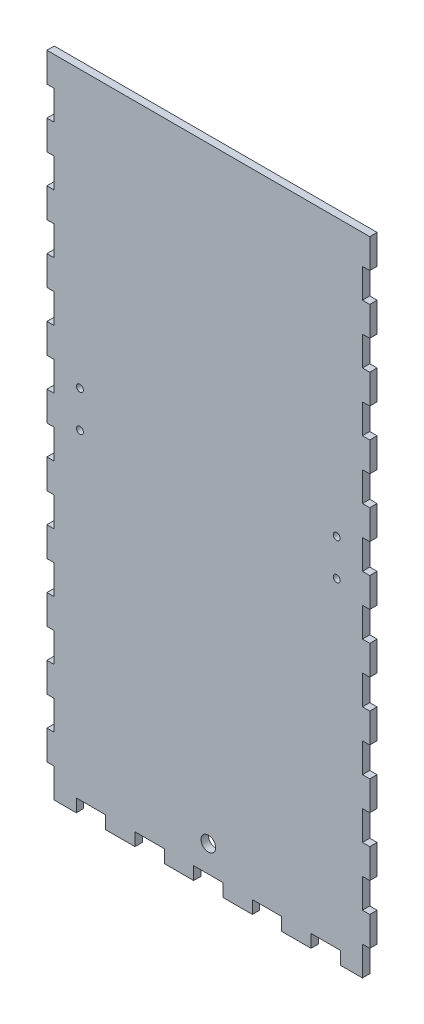
from build123d import *

# Parameters (mm, degrees)
BOSS_EXTRUDE1_DEPTH = 3.175
SKETCH2_R           = 3.175
CUT_EXTRUDE1_DEPTH  = 283.598857869
SKETCH3_R           = 1.5
CUT_EXTRUDE2_DEPTH  = 283.598857869


with BuildPart() as part:
    # Sketch1 → Boss-Extrude1 (new body)
    with BuildSketch(Plane.XY):
        Polygon((-69.85, 273.812), (-69.85, 261.112), (-66.675, 261.112), (-66.675, 248.412), (-69.85, 248.412), (-69.85, 235.712), (-66.675, 235.712), (-66.675, 223.012), (-69.85, 223.012), (-69.85, 210.312), (-66.675, 210.312), (-66.675, 197.612), (-69.85, 197.612), (-69.85, 184.912), (-66.675, 184.912), (-66.675, 172.212), (-69.85, 172.212), (-69.85, 159.512), (-66.675, 159.512), (-66.675, 146.812), (-69.85, 146.812), (-69.85, 134.112), (-66.675, 134.112), (-66.675, 121.412), (-69.85, 121.412), (-69.85, 108.712), (-66.675, 108.712), (-66.675, 96.012), (-69.85, 96.012), (-69.85, 83.312), (-66.675, 83.312), (-66.675, 70.612), (-69.85, 70.612), (-69.85, 57.912), (-66.675, 57.912), (-66.675, 45.212), (-69.85, 45.212), (-69.85, 32.512), (-66.675, 32.512), (-66.675, 19.812), (-69.85, 19.812), (-69.85, 7.112), (-66.675, 7.112), (-66.675, -5.588), (-57.15, -5.588), (-57.15, 0), (-44.45, 0), (-44.45, -5.588), (-31.75, -5.588), (-31.75, 0), (-19.05, 0), (-19.05, -5.588), (-6.35, -5.588), (-6.35, 0), (6.35, 0), (6.35, -5.588), (19.05, -5.588), (19.05, 0), (31.75, 0), (31.75, -5.588), (44.45, -5.588), (44.45, 0), (57.15, 0), (57.15, -5.588), (66.675, -5.588), (66.675, 7.112), (69.85, 7.112), (69.85, 19.812), (66.675, 19.812), (66.675, 32.512), (69.85, 32.512), (69.85, 45.212), (66.675, 45.212), (66.675, 57.912), (69.85, 57.912), (69.85, 70.612), (66.675, 70.612), (66.675, 83.312), (69.85, 83.312), (69.85, 96.012), (66.675, 96.012), (66.675, 108.712), (69.85, 108.712), (69.85, 121.412), (66.675, 121.412), (66.675, 134.112), (69.85, 134.112), (69.85, 146.812), (66.675, 146.812), (66.675, 159.512), (69.85, 159.512), (69.85, 172.212), (66.675, 172.212), (66.675, 184.912), (69.85, 184.912), (69.85, 197.612), (66.675, 197.612), (66.675, 210.312), (69.85, 210.312), (69.85, 223.012), (66.675, 223.012), (66.675, 235.712), (69.85, 235.712), (69.85, 248.412), (66.675, 248.412), (66.675, 261.112), (69.85, 261.112), (69.85, 273.812), align=None)
    extrude(amount=BOSS_EXTRUDE1_DEPTH)

    # Sketch2 → Cut-Extrude1 (cut, through all)
    with BuildSketch(Plane.XY.offset(3.175)):
        with Locations((0, 11.43)):
            Circle(SKETCH2_R)
    extrude(amount=-CUT_EXTRUDE1_DEPTH, mode=Mode.SUBTRACT)

    # Sketch3 → Cut-Extrude2 (cut, through all)
    with BuildSketch(Plane.XY.offset(3.175)):
        with Locations((-55.5625, 154.305)):
            Circle(SKETCH3_R)
        with Locations((-55.5625, 138.557)):
            Circle(SKETCH3_R)
        with Locations((55.5625, 154.305)):
            Circle(SKETCH3_R)
        with Locations((55.5625, 138.557)):
            Circle(SKETCH3_R)
    extrude(amount=-CUT_EXTRUDE2_DEPTH, mode=Mode.SUBTRACT)


solid = part.part
